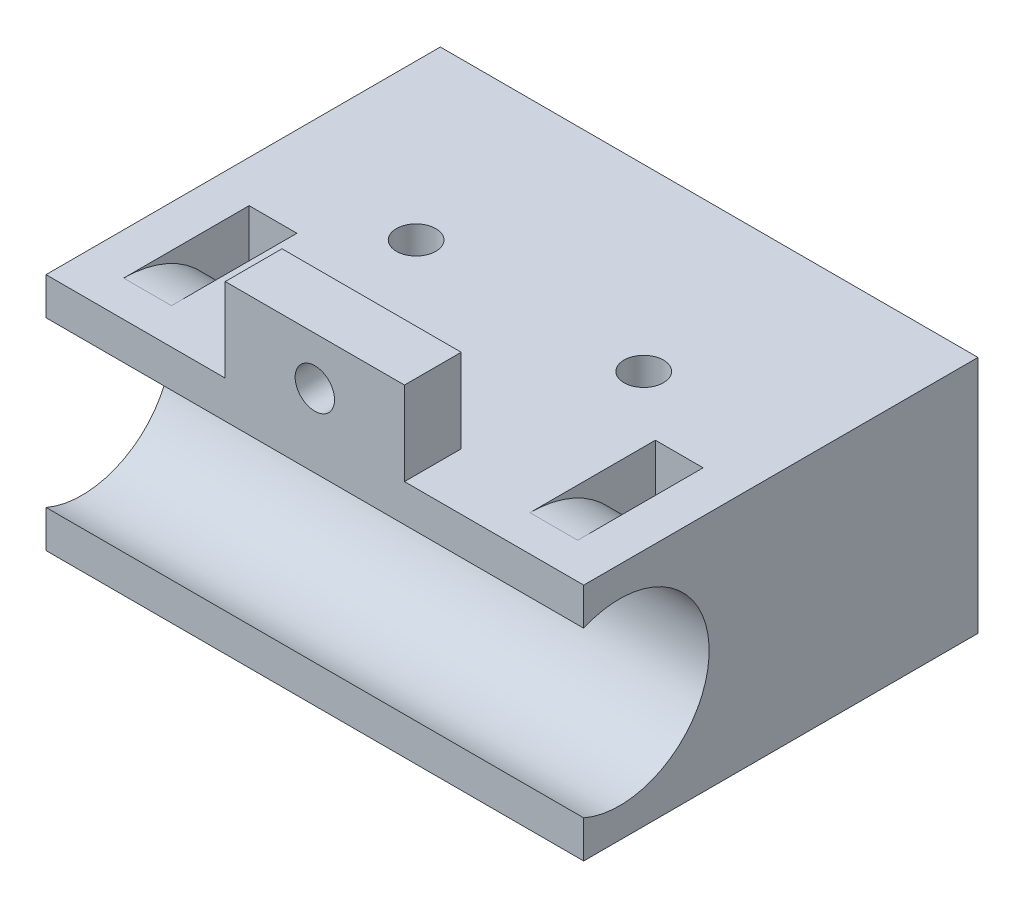
from build123d import *

# Parameters (mm, degrees)
SKETCH2_W                 = 45
SKETCH2_H                 = 20
BOSS_EXTRUDE1_DEPTH       = 33
M4X0_7_TAPPED_HOLE1_D     = 3.3
SKETCH3_R                 = 7.5
CUT_EXTRUDE1_DEPTH        = 45
SKETCH4_R                 = 4
CUT_EXTRUDE2_DEPTH        = 10
M3X0_5_TAPPED_HOLE1_D     = 2.5
M3X0_5_TAPPED_HOLE1_DEPTH = 8.5
M3X0_5_TAPPED_HOLE1_TIP   = 0.751075774
SKETCH5_W                 = 4
SKETCH5_H                 = 1.5
CUT_EXTRUDE3_DEPTH        = 39
FILLET1_R                 = 9
SKETCH8_W                 = 15
SKETCH8_H                 = 4.75
BOSS_EXTRUDE2_DEPTH       = 7
M4X0_7_TAPPED_HOLE3_D     = 3.3
BODY_MOVE_COPY1_ANGLE     = 180


with BuildPart() as part:
    # Sketch2 → Boss-Extrude1 (new body)
    with BuildSketch(Plane.XY):
        Rectangle(SKETCH2_W, SKETCH2_H)
    extrude(amount=BOSS_EXTRUDE1_DEPTH)

    # M4x0.7 Tapped Hole1 (through all)
    with Locations(Plane(origin=(0, -10, 0), x_dir=(-1, 0, 0), z_dir=(0, -1, 0))):
        with Locations((-9.525, -15), (9.525, -15)):
            Hole(M4X0_7_TAPPED_HOLE1_D / 2)

    # Sketch3 → Cut-Extrude1 (cut)
    with BuildSketch(Plane(origin=(22.5, 0, 0), x_dir=(0, 0, -1), z_dir=(1, 0, 0))):
        with Locations((-30, 0)):
            Circle(SKETCH3_R)
    extrude(amount=-CUT_EXTRUDE1_DEPTH, mode=Mode.SUBTRACT)

    # Sketch4 → Cut-Extrude2 (cut)
    with BuildSketch(Plane(origin=(0, 0, 0), x_dir=(-1, 0, 0), z_dir=(0, 0, -1))):
        with Locations((-15, 0)):
            Circle(SKETCH4_R)
        with Locations((15, 0)):
            Circle(SKETCH4_R)
    extrude(amount=-CUT_EXTRUDE2_DEPTH, mode=Mode.SUBTRACT)

    # M3x0.5 Tapped Hole1
    with Locations(Plane(origin=(0, 10, 0), x_dir=(1, 0, 0), z_dir=(0, 1, 0))):
        with Locations((9.525, -5), (-9.525, -5)):
            Hole(M3X0_5_TAPPED_HOLE1_D / 2, depth=M3X0_5_TAPPED_HOLE1_DEPTH)
            with Locations((0, 0, -(M3X0_5_TAPPED_HOLE1_DEPTH + M3X0_5_TAPPED_HOLE1_TIP / 2))):  # 118° drill point
                Cone(0, M3X0_5_TAPPED_HOLE1_D / 2, M3X0_5_TAPPED_HOLE1_TIP, mode=Mode.SUBTRACT)

    # Sketch5 → Cut-Extrude3 (cut)
    with BuildSketch(Plane.XZ.offset(10)):
        with Locations((-17, 20.25)):
            Rectangle(SKETCH5_W, SKETCH5_H)
        with Locations((17, 20.25)):
            Rectangle(SKETCH5_W, SKETCH5_H)
    extrude(amount=-CUT_EXTRUDE3_DEPTH, mode=Mode.SUBTRACT)

    # Fillet1
    fillet1_edges = [part.edges().sort_by_distance(p)[0] for p in [
        (17, -10, 21),
        (-17, -10, 21),
    ]]
    fillet(fillet1_edges, radius=FILLET1_R)

    # Sketch8 → Boss-Extrude2 (add)
    with BuildSketch(Plane.XZ.offset(10)):
        with Locations((0, 30.625)):
            Rectangle(SKETCH8_W, SKETCH8_H)
    extrude(amount=BOSS_EXTRUDE2_DEPTH)

    # M4x0.7 Tapped Hole3 (through all)
    with Locations(Plane(origin=(0, 0, 28.25), x_dir=(-1, 0, 0), z_dir=(0, 0, -1))):
        with Locations((0, -13)):
            Hole(M4X0_7_TAPPED_HOLE3_D / 2)


with BuildPart() as part_1:
    # Body-Move/Copy1: moved
    add(part.part.rotate(Axis((0, -3.5, 0), (0, 0, 1)), BODY_MOVE_COPY1_ANGLE))


solid = part_1.part
